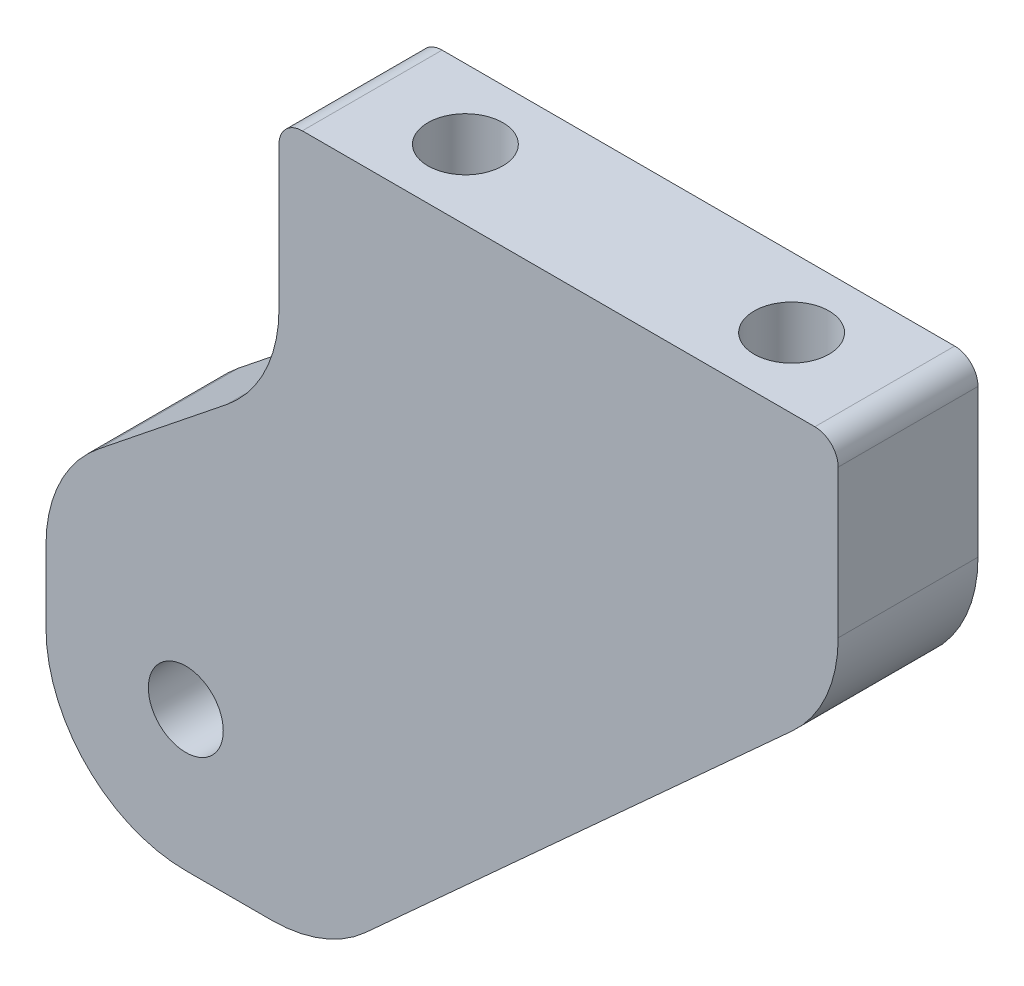
from build123d import *

# Parameters (mm, degrees)
SKETCH1_W                   = 53.975
SKETCH1_H                   = 47.625
BASE_FLANGE1_DEPTH          = 9.525
F_1_4_20_TAPPED_HOLE1_D     = 5.1054
F_1_4_20_TAPPED_HOLE1_DEPTH = 19.05
F_1_4_20_TAPPED_HOLE1_TIP   = 1.533816902
CUT_EXTRUDE1_DEPTH          = 38.230175094
CUT_EXTRUDE2_REACH          = 39.23
F_1_4_20_TAPPED_HOLE2_D     = 5.1054
F_1_4_20_TAPPED_HOLE2_DEPTH = 9.525
CUT_EXTRUDE3_REACH          = 39.23
FILLET2_R                   = 1.5875
FILLET1_R                   = 9.525


# Sheet-metal steps are written as plain solids
with BuildPart() as part:
    # Sketch1 → Base-Flange1 (new body)
    with BuildSketch(Plane.XY):
        Rectangle(SKETCH1_W, SKETCH1_H)
    extrude(amount=BASE_FLANGE1_DEPTH)

    # 1/4-20 Tapped Hole1
    with Locations(Plane(origin=(0, 23.8125, 0), x_dir=(1, 0, 0), z_dir=(0, 1, 0))):
        with Locations((-3.175, -4.7625), (19.05, -4.7625)):
            Hole(F_1_4_20_TAPPED_HOLE1_D / 2, depth=F_1_4_20_TAPPED_HOLE1_DEPTH)
            with Locations((0, 0, -(F_1_4_20_TAPPED_HOLE1_DEPTH + F_1_4_20_TAPPED_HOLE1_TIP / 2))):  # 118° drill point
                Cone(0, F_1_4_20_TAPPED_HOLE1_D / 2, F_1_4_20_TAPPED_HOLE1_TIP, mode=Mode.SUBTRACT)

    # Sketch4 → Cut-Extrude1 (cut, through all)
    with BuildSketch(Plane(origin=(0, 0, 0), x_dir=(-1, 0, 0), z_dir=(0, 0, -1))):
        with BuildLine():
            Line((17.5895, -14.224), (17.5895, -14.351))
            ThreePointArc((17.5895, -14.351), (17.4625, -14.478), (17.3355, -14.351))
            Line((17.3355, -14.351), (17.3355, -14.224))
            ThreePointArc((17.3355, -14.224), (17.4625, -14.097), (17.5895, -14.224))
        make_face()
    extrude(amount=-CUT_EXTRUDE1_DEPTH, mode=Mode.SUBTRACT)

    # Sketch5 → Cut-Extrude2 (cut, up to next)
    with BuildSketch(Plane.XY.offset(9.525), mode=Mode.PRIVATE) as cut_extrude2_sk1:
        Polygon((26.9875, -23.8125), (26.9875, 7.9375), (-7.9375, -23.8125), align=None)
    cut_extrude2_tool1 = extrude(cut_extrude2_sk1.sketch, amount=-CUT_EXTRUDE2_REACH, mode=Mode.PRIVATE) & part.part
    add(cut_extrude2_tool1.solids().sort_by_distance((15.345833, -13.229167, 9.525))[0], mode=Mode.SUBTRACT)

    # 1/4-20 Tapped Hole2
    with Locations(Plane.XY.offset(9.525)):
        with Locations((-17.4625, -14.2875)):
            Hole(F_1_4_20_TAPPED_HOLE2_D / 2, depth=F_1_4_20_TAPPED_HOLE2_DEPTH)

    # Sketch8 → Cut-Extrude3 (cut, up to next)
    with BuildSketch(Plane.XY.offset(9.525), mode=Mode.PRIVATE) as cut_extrude3_sk1:
        Polygon((-26.9875, -4.7625), (-11.1125, 7.9375), (-11.1125, 23.8125), (-26.9875, 23.8125), align=None)
    cut_extrude3_tool1 = extrude(cut_extrude3_sk1.sketch, amount=-CUT_EXTRUDE3_REACH, mode=Mode.PRIVATE) & part.part
    add(cut_extrude3_tool1.solids().sort_by_distance((-19.805952, 12.397619, 9.525))[0], mode=Mode.SUBTRACT)

    # Fillet2
    fillet2_edges = [part.edges().sort_by_distance(p)[0] for p in [
        (-11.1125, 23.8125, 4.7625),
        (26.9875, 23.8125, 4.7625),
    ]]
    fillet(fillet2_edges, radius=FILLET2_R)

    # Fillet1
    fillet1_edges = [part.edges().sort_by_distance(p)[0] for p in [
        (-7.9375, -23.8125, 4.7625),
        (26.9875, 7.9375, 4.7625),
        (-11.1125, 7.9375, 4.7625),
        (-26.9875, -4.7625, 4.7625),
        (-26.9875, -23.8125, 4.7625),
    ]]
    fillet(fillet1_edges, radius=FILLET1_R)


solid = part.part
